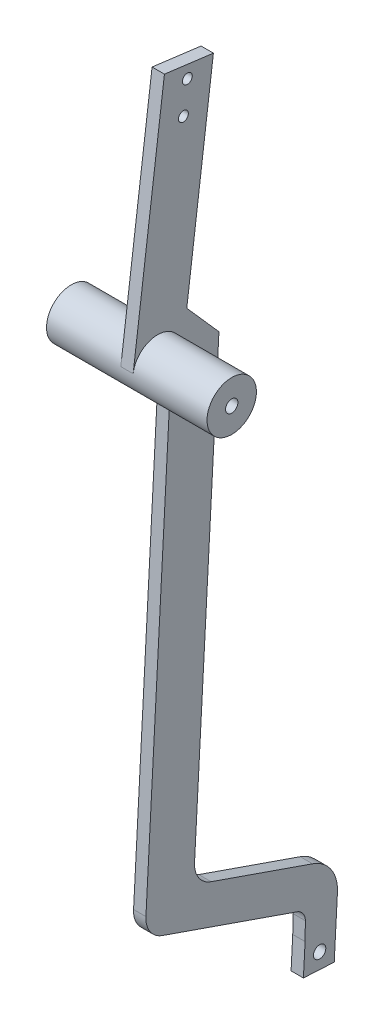
from build123d import *

# Parameters (mm, degrees)
SKETCH3_R           = 20
SKETCH3_R_2         = 5
BOSS_EXTRUDE1_DEPTH = 65
SKETCH5_R           = 4
BOSS_EXTRUDE2_DEPTH = 5
SKETCH6_R           = 5
BOSS_EXTRUDE3_DEPTH = 5


with BuildPart() as part:
    # Sketch3 → Boss-Extrude1 (new, symmetric)
    with BuildSketch(Plane(origin=(-60.993597041, 927.302486426, 511.524423855), x_dir=(7.084999161145914e-07, -0.9985151410564701, 0.05447488485968174), z_dir=(0.9999999999388507, 1.062545286619565e-07, -1.105836500523453e-05))):
        with Locations((-394.045278836, 76.348788506)):
            Circle(SKETCH3_R)
        with Locations((-394.045278836, 76.348788506)):
            Circle(SKETCH3_R_2, mode=Mode.SUBTRACT)
    extrude(amount=BOSS_EXTRUDE1_DEPTH, both=True)

    # Sketch5 → Boss-Extrude2 (add, symmetric)
    with BuildSketch(Plane(origin=(-60.993597041, 927.302486426, 511.524423855), x_dir=(7.084999161145914e-07, -0.9985151410564701, 0.05447488485968174), z_dir=(0.9999999999388507, 1.062545286619565e-07, -1.105836500523453e-05))):
        with BuildLine():
            Line((-392.58424152, 96.295351367), (-591.123204204, 110.837848496))
            Line((-591.123204204, 110.837848496), (-594.045278836, 70.944722775))
            Line((-594.045278836, 70.944722775), (-395.506316152, 56.402225645))
            ThreePointArc((-395.506316152, 56.402225645), (-413.991841697, 77.809825822), (-392.58424152, 96.295351367))
        make_face()
        with Locations((-582.61096009, 90.160766978)):
            Circle(SKETCH5_R, mode=Mode.SUBTRACT)
        with Locations((-557.677756514, 88.334470333)):
            Circle(SKETCH5_R, mode=Mode.SUBTRACT)
    extrude(amount=BOSS_EXTRUDE2_DEPTH, both=True)

    # Sketch6 → Boss-Extrude3 (add, symmetric)
    with BuildSketch(Plane(origin=(-60.993597041, 927.302486426, 511.524423855), x_dir=(7.084999161145914e-07, -0.9985151410564701, 0.05447488485968174), z_dir=(0.9999999999388507, 1.062545286619565e-07, -1.105836500523453e-05))):
        with BuildLine():
            Line((-377.619831435, 87.759514937), (-10.701600418, 87.759514937))
            ThreePointArc((-10.701600418, 87.759514937), (1.33121872, 91.784181964), (8.521228815, 102.238388578))
            Line((8.521228815, 102.238388578), (40.370826321, 213.128691433))
            ThreePointArc((40.370826321, 213.128691433), (43.807033497, 218.233674202), (49.581691002, 220.360103021))
            Line((49.581691002, 220.360103021), (64.120567224, 220.942925342))
            Line((64.120567224, 220.942925342), (89.013518657, 220.942925342))
            Line((89.013518657, 220.942925342), (89.013518657, 245.942925342))
            Line((89.013518657, 245.942925342), (64.013518657, 245.942925342))
            Line((64.013518657, 245.942925342), (41.179122583, 245.942925342))
            ThreePointArc((41.179122583, 245.942925342), (23.129893875, 239.905924801), (12.344878733, 224.22461488))
            Line((12.344878733, 224.22461488), (-11.683288106, 140.566078935))
            ThreePointArc((-11.683288106, 140.566078935), (-18.873298201, 130.11187232), (-30.906117339, 126.087205293))
            Line((-30.906117339, 126.087205293), (-394.045278836, 126.087205293))
            Line((-394.045278836, 126.087205293), (-422.057084413, 98.454165573))
            Line((-422.057084413, 98.454165573), (-387.307739228, 95.179761928))
            ThreePointArc((-387.307739228, 95.179761928), (-381.884028565, 92.22657147), (-377.619831435, 87.759514937))
        make_face()
        with Locations((76.540338219, 233.416105781)):
            Circle(SKETCH6_R, mode=Mode.SUBTRACT)
    extrude(amount=BOSS_EXTRUDE3_DEPTH, both=True)


solid = part.part
